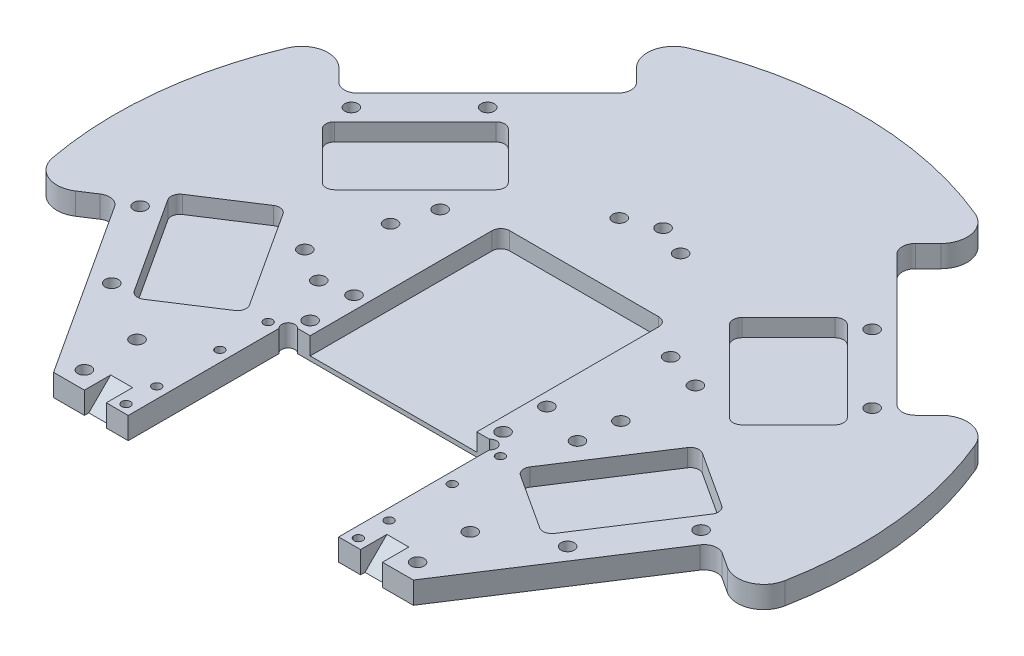
from build123d import *

# Parameters (mm, degrees)
SKETCH1_R            = 85
BOSS_EXTRUDE1_DEPTH  = 5
CUT_EXTRUDE1_REACH   = 122.312
SKETCH2_R            = 1.5
CUT_EXTRUDE2_DEPTH   = 4
FILLET2_R            = 2
FILLET3_R            = 6
FILLET4_R            = 3
FILLET2_OF_MIRROR1_R = 2
FILLET3_OF_MIRROR1_R = 6
FILLET4_OF_MIRROR1_R = 3
MIRROR2_START        = 1
MIRROR2_OUTLINE_R    = 1.5
MIRROR2_DEPTH        = 4
MIRROR2_2_OUTLINE_R  = 1.5
MIRROR2_2_DEPTH      = 1
CUT_EXTRUDE3_REACH   = 122.312
CUT_EXTRUDE4_REACH   = 122.312
SKETCH5_R            = 1.5
CUT_EXTRUDE5_REACH   = 122.312
SKETCH6_R            = 1.5
CUT_EXTRUDE6_REACH   = 122.312
SKETCH7_R            = 1.5
CUT_EXTRUDE7_REACH   = 122.312
SKETCH8_R            = 1
SKETCH8_R_2          = 1.5
CUT_EXTRUDE8_START   = -5
CUT_EXTRUDE8_DEPTH   = 5
CUT_EXTRUDE9_DEPTH   = 4


# Read off the part's stored shape, not the designer's step: Mirror2
with BuildPart() as part:
    # Sketch1 → Boss-Extrude1 (new body)
    with BuildSketch(Plane(origin=(0, 0, 0), x_dir=(1, 0, 0), z_dir=(0, 1, 0))):
        with Locations(Location((0, 0, 0), (0, 0, 270))):
            Circle(SKETCH1_R)
    extrude(amount=BOSS_EXTRUDE1_DEPTH)

    # Sketch2 → Cut-Extrude1 (cut, up to next)
    with BuildSketch(Plane(origin=(0, 5, 0), x_dir=(1, 0, 0), z_dir=(0, 1, 0)), mode=Mode.PRIVATE) as cut_extrude1_sk1:
        with Locations(Location((-59.39696962, 28.284271247, 0), (0, 0, 270))):
            Circle(SKETCH2_R)
    cut_extrude1_tool1 = extrude(cut_extrude1_sk1.sketch, amount=-CUT_EXTRUDE1_REACH, mode=Mode.PRIVATE) & part.part
    # Sketch2 → Cut-Extrude1 (cut, up to next)
    with BuildSketch(Plane(origin=(0, 5, 0), x_dir=(1, 0, 0), z_dir=(0, 1, 0)), mode=Mode.PRIVATE) as cut_extrude1_sk2:
        with Locations(Location((-43.840620434, 43.840620434, 0), (0, 0, 270))):
            Circle(SKETCH2_R)
    cut_extrude1_tool2 = extrude(cut_extrude1_sk2.sketch, amount=-CUT_EXTRUDE1_REACH, mode=Mode.PRIVATE) & part.part
    # Sketch2 → Cut-Extrude1 (cut, up to next)
    with BuildSketch(Plane(origin=(0, 5, 0), x_dir=(1, 0, 0), z_dir=(0, 1, 0)), mode=Mode.PRIVATE) as cut_extrude1_sk3:
        with BuildLine():
            Line((-40.687914512, 74.629040009), (-29.69848481, 63.639610307))
            Line((-29.69848481, 63.639610307), (-63.639610307, 29.69848481))
            Line((-63.639610307, 29.69848481), (-74.629040009, 40.687914512))
            ThreePointArc((-74.629040009, 40.687914512), (-60.104076401, 60.104076401), (-40.687914512, 74.629040009))
        make_face()
    cut_extrude1_tool3 = extrude(cut_extrude1_sk3.sketch, amount=-CUT_EXTRUDE1_REACH, mode=Mode.PRIVATE) & part.part
    cut_extrude1_1 = cut_extrude1_tool1.solids().sort_by_distance((-59.39697, 5, -28.284271))[0]
    add(cut_extrude1_1, mode=Mode.SUBTRACT)
    cut_extrude1_2 = cut_extrude1_tool2.solids().sort_by_distance((-43.84062, 5, -43.84062))[0]
    add(cut_extrude1_2, mode=Mode.SUBTRACT)
    cut_extrude1_3 = cut_extrude1_tool3.solids().sort_by_distance((-53.003264, 5, -53.003264))[0]
    add(cut_extrude1_3, mode=Mode.SUBTRACT)
    cut_extrude1 = cut_extrude1_1 + cut_extrude1_2 + cut_extrude1_3  # Cut-Extrude1 as one shape, for the pattern or mirror that repeats it

    # Sketch3 → Cut-Extrude2 (cut)
    with BuildSketch(Plane(origin=(0, 5, 0), x_dir=(1, 0, 0), z_dir=(0, 1, 0))):
        Polygon((-59.877802231, 22.146584387), (-38.664598795, 43.359787822), (-25.229569953, 29.92475898), (-46.442773388, 8.711555544), align=None)
    cut_extrude2 = extrude(amount=-CUT_EXTRUDE2_DEPTH, mode=Mode.SUBTRACT)

    # Fillet2
    fillet2_edges = [part.edges().sort_by_distance(p)[0] for p in [
        (-46.442773388, 3, -8.711555544),
        (-59.877802231, 3, -22.146584387),
        (-38.664598795, 3, -43.359787822),
        (-25.229569953, 3, -29.92475898),
    ]]
    fillet(fillet2_edges, radius=FILLET2_R)

    # Fillet3
    fillet3_edges = [part.edges().sort_by_distance(p)[0] for p in [
        (-40.687914512, 2.5, -74.629040009),
        (-74.629040009, 2.5, -40.687914512),
    ]]
    fillet(fillet3_edges, radius=FILLET3_R)

    # Fillet4
    fillet4_edges = [part.edges().sort_by_distance(p)[0] for p in [
        (-29.69848481, 2.5, -63.639610307),
        (-63.639610307, 2.5, -29.69848481),
    ]]
    fillet(fillet4_edges, radius=FILLET4_R)

    # Mirror1: Cut-Extrude1, Cut-Extrude2 across plane
    add(cut_extrude1.mirror(Plane(origin=(0, 0, 0), x_dir=(0.9945218953682733, 0, 0.10452846326765369), z_dir=(-0.10452846326765369, 0, 0.9945218953682733))), mode=Mode.SUBTRACT)
    add(cut_extrude2.mirror(Plane(origin=(0, 0, 0), x_dir=(0.9945218953682733, 0, 0.10452846326765369), z_dir=(-0.10452846326765369, 0, 0.9945218953682733))), mode=Mode.SUBTRACT)

    # Fillet2 of Mirror1
    fillet2_of_mirror1_edges = [part.edges().sort_by_distance(p)[0] for p in [
        (-47.239121604, 3, -1.134808387),
        (-63.173862395, 3, 9.213333278),
        (-46.834691345, 3, 34.373450316),
        (-30.899950554, 3, 24.025308651),
    ]]
    fillet(fillet2_of_mirror1_edges, radius=FILLET2_OF_MIRROR1_R)

    # Fillet3 of Mirror1
    fillet3_of_mirror1_edges = [part.edges().sort_by_distance(p)[0] for p in [
        (-55.315035851, 2.5, 64.538723328),
        (-81.457709532, 2.5, 24.282536066),
    ]]
    fillet(fillet3_of_mirror1_edges, radius=FILLET3_OF_MIRROR1_R)

    # Fillet4 of Mirror1
    fillet4_of_mirror1_edges = [part.edges().sort_by_distance(p)[0] for p in [
        (-42.280920644, 2.5, 56.074269942),
        (-68.423594325, 2.5, 15.81808268),
    ]]
    fillet(fillet4_of_mirror1_edges, radius=FILLET4_OF_MIRROR1_R)

    # Mirror2 outline → Mirror2 (cut)
    with BuildSketch(Plane(origin=(0, 0, 0), x_dir=(1, 0, 0), z_dir=(0, 1, 0)).offset(MIRROR2_START)):
        with BuildLine():
            ThreePointArc((43.914837749, -53.558258238), (43.496406651, -55.815910416), (44.796932348, -57.708187047))
            Line((44.796932348, -57.708187047), (48.220507685, -59.931482867))
            ThreePointArc((48.220507685, -59.931482867), (50.952027138, -64.875440225), (48.366800574, -69.89744346))
            ThreePointArc((48.366800574, -69.89744346), (71.286998275, -46.294317976), (83.527042075, -15.755419453))
            ThreePointArc((83.527042075, -15.755419453), (79.990720206, -20.159774174), (74.363181366, -19.675295605))
            Line((74.363181366, -19.675295605), (70.939606029, -17.451999785))
            ThreePointArc((70.939606029, -17.451999785), (68.681953851, -17.033568687), (66.78967722, -18.334094384))
            Line((66.78967722, -18.334094384), (43.914837749, -53.558258238))
        make_face()
        with BuildLine():
            ThreePointArc((68.647443459, 34.706317962), (74.051278315, 36.350240628), (78.426039904, 32.777374283))
            ThreePointArc((78.426039904, 32.777374283), (60.1040764, 60.1040764), (32.777374283, 78.426039904))
            ThreePointArc((32.777374283, 78.426039904), (36.350240628, 74.051278315), (34.706317962, 68.647443459))
            Line((34.706317962, 68.647443459), (31.819805153, 65.76093065))
            ThreePointArc((31.819805153, 65.76093065), (30.941125497, 63.639610307), (31.819805153, 61.518289963))
            Line((31.819805153, 61.518289963), (61.518289963, 31.819805153))
            ThreePointArc((61.518289963, 31.819805153), (63.639610307, 30.941125497), (65.76093065, 31.819805153))
            Line((65.76093065, 31.819805153), (68.647443459, 34.706317962))
        make_face()
        with Locations((63.979633983, -15.316867676)):
            Circle(MIRROR2_OUTLINE_R)
        with Locations((51.997575213, -33.767620171)):
            Circle(MIRROR2_OUTLINE_R)
        with BuildLine():
            ThreePointArc((62.084584325, -10.890674414), (62.363538391, -9.385572962), (61.496521259, -8.124055208))
            Line((61.496521259, -8.124055208), (48.91646274, 0.045530317))
            ThreePointArc((48.91646274, 0.045530317), (47.411361288, 0.324484383), (46.149843534, -0.542532749))
            Line((46.149843534, -0.542532749), (31.989228624, -22.347967515))
            ThreePointArc((31.989228624, -22.347967515), (31.710274558, -23.853068967), (32.57729169, -25.114586721))
            Line((32.57729169, -25.114586721), (45.157350209, -33.284172246))
            ThreePointArc((45.157350209, -33.284172246), (46.66245166, -33.563126312), (47.923969415, -32.696109181))
            Line((47.923969415, -32.696109181), (62.084584325, -10.890674414))
        make_face()
        with Locations((59.39696962, 28.284271247)):
            Circle(MIRROR2_OUTLINE_R)
        with Locations((43.840620434, 43.840620434)):
            Circle(MIRROR2_OUTLINE_R)
        with BuildLine():
            Line((47.856986951, 10.125769107), (58.463588669, 20.732370824))
            ThreePointArc((58.463588669, 20.732370824), (59.049375106, 22.146584387), (58.463588669, 23.560797949))
            Line((58.463588669, 23.560797949), (40.078812358, 41.94557426))
            ThreePointArc((40.078812358, 41.94557426), (38.664598796, 42.531360698), (37.250385233, 41.94557426))
            Line((37.250385233, 41.94557426), (26.643783515, 31.338972542))
            ThreePointArc((26.643783515, 31.338972542), (26.057997077, 29.924758979), (26.643783515, 28.510545417))
            Line((26.643783515, 28.510545417), (45.028559826, 10.125769107))
            ThreePointArc((45.028559826, 10.125769107), (46.442773389, 9.539982669), (47.856986951, 10.125769107))
        make_face()
    extrude(amount=MIRROR2_DEPTH, mode=Mode.SUBTRACT)

    # Mirror2 2 outline → Mirror2 2 (cut)
    with BuildSketch(Plane(origin=(0, 0, 0), x_dir=(1, 0, 0), z_dir=(0, 1, 0))):
        with BuildLine():
            ThreePointArc((43.914837749, -53.558258238), (43.496406651, -55.815910416), (44.796932348, -57.708187047))
            Line((44.796932348, -57.708187047), (48.220507685, -59.931482867))
            ThreePointArc((48.220507685, -59.931482867), (50.952027138, -64.875440225), (48.366800574, -69.89744346))
            ThreePointArc((48.366800574, -69.89744346), (71.286998275, -46.294317976), (83.527042075, -15.755419453))
            ThreePointArc((83.527042075, -15.755419453), (79.990720206, -20.159774174), (74.363181366, -19.675295605))
            Line((74.363181366, -19.675295605), (70.939606029, -17.451999785))
            ThreePointArc((70.939606029, -17.451999785), (68.681953851, -17.033568687), (66.78967722, -18.334094384))
            Line((66.78967722, -18.334094384), (43.914837749, -53.558258238))
        make_face()
        with BuildLine():
            ThreePointArc((68.647443459, 34.706317962), (74.051278315, 36.350240628), (78.426039904, 32.777374283))
            ThreePointArc((78.426039904, 32.777374283), (60.1040764, 60.1040764), (32.777374283, 78.426039904))
            ThreePointArc((32.777374283, 78.426039904), (36.350240628, 74.051278315), (34.706317962, 68.647443459))
            Line((34.706317962, 68.647443459), (31.819805153, 65.76093065))
            ThreePointArc((31.819805153, 65.76093065), (30.941125497, 63.639610307), (31.819805153, 61.518289963))
            Line((31.819805153, 61.518289963), (61.518289963, 31.819805153))
            ThreePointArc((61.518289963, 31.819805153), (63.639610307, 30.941125497), (65.76093065, 31.819805153))
            Line((65.76093065, 31.819805153), (68.647443459, 34.706317962))
        make_face()
        with Locations((63.979633983, -15.316867676)):
            Circle(MIRROR2_2_OUTLINE_R)
        with Locations((51.997575213, -33.767620171)):
            Circle(MIRROR2_2_OUTLINE_R)
        with Locations((59.39696962, 28.284271247)):
            Circle(MIRROR2_2_OUTLINE_R)
        with Locations((43.840620434, 43.840620434)):
            Circle(MIRROR2_2_OUTLINE_R)
    extrude(amount=MIRROR2_2_DEPTH, mode=Mode.SUBTRACT)

    # Sketch4 → Cut-Extrude3 (cut, up to next)
    with BuildSketch(Plane(origin=(0, 5, 0), x_dir=(1, 0, 0), z_dir=(0, 1, 0)), mode=Mode.PRIVATE) as cut_extrude3_sk1:
        Polygon((-43.914837749, -53.558258238), (-41.030336922, -58), (-24, -58), (-24, -21.5), (24, -21.5), (24, -58), (41.030336922, -58), (43.914837749, -53.558258238), (50.952673475, -58.128682198), (50.952673475, -85), (-50.952673475, -85), (-50.952673475, -58.128682198), align=None)
    cut_extrude3_tool1 = extrude(cut_extrude3_sk1.sketch, amount=-CUT_EXTRUDE3_REACH, mode=Mode.PRIVATE) & part.part
    add(cut_extrude3_tool1.solids().sort_by_distance((0, 5, 59.123155))[0], mode=Mode.SUBTRACT)

    # Sketch5 → Cut-Extrude4 (cut, up to next)
    with BuildSketch(Plane(origin=(0, 5, 0), x_dir=(1, 0, 0), z_dir=(0, 1, 0)), mode=Mode.PRIVATE) as cut_extrude4_sk1:
        with Locations((-23, -22.5)):
            Circle(SKETCH5_R)
    cut_extrude4_tool1 = extrude(cut_extrude4_sk1.sketch, amount=-CUT_EXTRUDE4_REACH, mode=Mode.PRIVATE) & part.part
    # Sketch5 → Cut-Extrude4 (cut, up to next)
    with BuildSketch(Plane(origin=(0, 5, 0), x_dir=(1, 0, 0), z_dir=(0, 1, 0)), mode=Mode.PRIVATE) as cut_extrude4_sk2:
        with Locations((23, -22.5)):
            Circle(SKETCH5_R)
    cut_extrude4_tool2 = extrude(cut_extrude4_sk2.sketch, amount=-CUT_EXTRUDE4_REACH, mode=Mode.PRIVATE) & part.part
    add(cut_extrude4_tool1.solids().sort_by_distance((-23, 5, 22.5))[0], mode=Mode.SUBTRACT)
    add(cut_extrude4_tool2.solids().sort_by_distance((23, 5, 22.5))[0], mode=Mode.SUBTRACT)

    # Sketch6 → Cut-Extrude5 (cut, up to next)
    with BuildSketch(Plane(origin=(0, 5, 0), x_dir=(1, 0, 0), z_dir=(0, 1, 0)), mode=Mode.PRIVATE) as cut_extrude5_sk1:
        with Locations(Location((-29.118657249, 18.25749709, 0), (0, 0, 270))):
            Circle(SKETCH6_R)
    cut_extrude5_tool1 = extrude(cut_extrude5_sk1.sketch, amount=-CUT_EXTRUDE5_REACH, mode=Mode.PRIVATE) & part.part
    # Sketch6 → Cut-Extrude5 (cut, up to next)
    with BuildSketch(Plane(origin=(0, 5, 0), x_dir=(1, 0, 0), z_dir=(0, 1, 0)), mode=Mode.PRIVATE) as cut_extrude5_sk2:
        with Locations(Location((-31.947084374, 9.772215716, 0), (0, 0, 270))):
            Circle(SKETCH6_R)
    cut_extrude5_tool2 = extrude(cut_extrude5_sk2.sketch, amount=-CUT_EXTRUDE5_REACH, mode=Mode.PRIVATE) & part.part
    # Sketch6 → Cut-Extrude5 (cut, up to next)
    with BuildSketch(Plane(origin=(0, 5, 0), x_dir=(1, 0, 0), z_dir=(0, 1, 0)), mode=Mode.PRIVATE) as cut_extrude5_sk3:
        with Locations(Location((-36.635404095, -5.095053168, 0), (0, 0, 270))):
            Circle(SKETCH6_R)
    cut_extrude5_tool3 = extrude(cut_extrude5_sk3.sketch, amount=-CUT_EXTRUDE5_REACH, mode=Mode.PRIVATE) & part.part
    # Sketch6 → Cut-Extrude5 (cut, up to next)
    with BuildSketch(Plane(origin=(0, 5, 0), x_dir=(1, 0, 0), z_dir=(0, 1, 0)), mode=Mode.PRIVATE) as cut_extrude5_sk4:
        with Locations(Location((-28.923609543, -9.625861571, 0), (0, 0, 270))):
            Circle(SKETCH6_R)
    cut_extrude5_tool4 = extrude(cut_extrude5_sk4.sketch, amount=-CUT_EXTRUDE5_REACH, mode=Mode.PRIVATE) & part.part
    # Sketch6 → Cut-Extrude5 (cut, up to next)
    with BuildSketch(Plane(origin=(0, 5, 0), x_dir=(1, 0, 0), z_dir=(0, 1, 0)), mode=Mode.PRIVATE) as cut_extrude5_sk5:
        with Locations(Location((33.280721823, -2.916497028, 0), (0, 0, 270))):
            Circle(SKETCH6_R)
    cut_extrude5_tool5 = extrude(cut_extrude5_sk5.sketch, amount=-CUT_EXTRUDE5_REACH, mode=Mode.PRIVATE) & part.part
    # Sketch6 → Cut-Extrude5 (cut, up to next)
    with BuildSketch(Plane(origin=(0, 5, 0), x_dir=(1, 0, 0), z_dir=(0, 1, 0)), mode=Mode.PRIVATE) as cut_extrude5_sk6:
        with Locations(Location((32.278291815, -11.804417711, 0), (0, 0, 270))):
            Circle(SKETCH6_R)
    cut_extrude5_tool6 = extrude(cut_extrude5_sk6.sketch, amount=-CUT_EXTRUDE5_REACH, mode=Mode.PRIVATE) & part.part
    # Sketch6 → Cut-Extrude5 (cut, up to next)
    with BuildSketch(Plane(origin=(0, 5, 0), x_dir=(1, 0, 0), z_dir=(0, 1, 0)), mode=Mode.PRIVATE) as cut_extrude5_sk7:
        with Locations(Location((26.290230125, 15.429069965, 0), (0, 0, 270))):
            Circle(SKETCH6_R)
    cut_extrude5_tool7 = extrude(cut_extrude5_sk7.sketch, amount=-CUT_EXTRUDE5_REACH, mode=Mode.PRIVATE) & part.part
    # Sketch6 → Cut-Extrude5 (cut, up to next)
    with BuildSketch(Plane(origin=(0, 5, 0), x_dir=(1, 0, 0), z_dir=(0, 1, 0)), mode=Mode.PRIVATE) as cut_extrude5_sk8:
        with Locations(Location((34.775511499, 12.600642841, 0), (0, 0, 270))):
            Circle(SKETCH6_R)
    cut_extrude5_tool8 = extrude(cut_extrude5_sk8.sketch, amount=-CUT_EXTRUDE5_REACH, mode=Mode.PRIVATE) & part.part
    add(cut_extrude5_tool1.solids().sort_by_distance((-29.118657, 5, -18.257497))[0], mode=Mode.SUBTRACT)
    add(cut_extrude5_tool2.solids().sort_by_distance((-31.947084, 5, -9.772216))[0], mode=Mode.SUBTRACT)
    add(cut_extrude5_tool3.solids().sort_by_distance((-36.635404, 5, 5.095053))[0], mode=Mode.SUBTRACT)
    add(cut_extrude5_tool4.solids().sort_by_distance((-28.92361, 5, 9.625862))[0], mode=Mode.SUBTRACT)
    add(cut_extrude5_tool5.solids().sort_by_distance((33.280722, 5, 2.916497))[0], mode=Mode.SUBTRACT)
    add(cut_extrude5_tool6.solids().sort_by_distance((32.278292, 5, 11.804418))[0], mode=Mode.SUBTRACT)
    add(cut_extrude5_tool7.solids().sort_by_distance((26.29023, 5, -15.42907))[0], mode=Mode.SUBTRACT)
    add(cut_extrude5_tool8.solids().sort_by_distance((34.775511, 5, -12.600643))[0], mode=Mode.SUBTRACT)

    # Sketch7 → Cut-Extrude6 (cut, up to next)
    with BuildSketch(Plane(origin=(0, 5, 0), x_dir=(1, 0, 0), z_dir=(0, 1, 0)), mode=Mode.PRIVATE) as cut_extrude6_sk1:
        with Locations(Location((0, 40, 0), (0, 0, 270))):
            Circle(SKETCH7_R)
    cut_extrude6_tool1 = extrude(cut_extrude6_sk1.sketch, amount=-CUT_EXTRUDE6_REACH, mode=Mode.PRIVATE) & part.part
    # Sketch7 → Cut-Extrude6 (cut, up to next)
    with BuildSketch(Plane(origin=(0, 5, 0), x_dir=(1, 0, 0), z_dir=(0, 1, 0)), mode=Mode.PRIVATE) as cut_extrude6_sk2:
        with Locations(Location((7, 37, 0), (0, 0, 270))):
            Circle(SKETCH7_R)
    cut_extrude6_tool2 = extrude(cut_extrude6_sk2.sketch, amount=-CUT_EXTRUDE6_REACH, mode=Mode.PRIVATE) & part.part
    # Sketch7 → Cut-Extrude6 (cut, up to next)
    with BuildSketch(Plane(origin=(0, 5, 0), x_dir=(1, 0, 0), z_dir=(0, 1, 0)), mode=Mode.PRIVATE) as cut_extrude6_sk3:
        with Locations(Location((-7, 37, 0), (0, 0, 270))):
            Circle(SKETCH7_R)
    cut_extrude6_tool3 = extrude(cut_extrude6_sk3.sketch, amount=-CUT_EXTRUDE6_REACH, mode=Mode.PRIVATE) & part.part
    # Sketch7 → Cut-Extrude6 (cut, up to next)
    with BuildSketch(Plane(origin=(0, 5, 0), x_dir=(1, 0, 0), z_dir=(0, 1, 0)), mode=Mode.PRIVATE) as cut_extrude6_sk4:
        with Locations(Location((-22, -8.5, 0), (0, 0, 270))):
            Circle(SKETCH7_R)
    cut_extrude6_tool4 = extrude(cut_extrude6_sk4.sketch, amount=-CUT_EXTRUDE6_REACH, mode=Mode.PRIVATE) & part.part
    # Sketch7 → Cut-Extrude6 (cut, up to next)
    with BuildSketch(Plane(origin=(0, 5, 0), x_dir=(1, 0, 0), z_dir=(0, 1, 0)), mode=Mode.PRIVATE) as cut_extrude6_sk5:
        with Locations(Location((-22, -18.5, 0), (0, 0, 270))):
            Circle(SKETCH7_R)
    cut_extrude6_tool5 = extrude(cut_extrude6_sk5.sketch, amount=-CUT_EXTRUDE6_REACH, mode=Mode.PRIVATE) & part.part
    # Sketch7 → Cut-Extrude6 (cut, up to next)
    with BuildSketch(Plane(origin=(0, 5, 0), x_dir=(1, 0, 0), z_dir=(0, 1, 0)), mode=Mode.PRIVATE) as cut_extrude6_sk6:
        with Locations(Location((22, -18.5, 0), (0, 0, 270))):
            Circle(SKETCH7_R)
    cut_extrude6_tool6 = extrude(cut_extrude6_sk6.sketch, amount=-CUT_EXTRUDE6_REACH, mode=Mode.PRIVATE) & part.part
    # Sketch7 → Cut-Extrude6 (cut, up to next)
    with BuildSketch(Plane(origin=(0, 5, 0), x_dir=(1, 0, 0), z_dir=(0, 1, 0)), mode=Mode.PRIVATE) as cut_extrude6_sk7:
        with Locations(Location((22, -8.5, 0), (0, 0, 270))):
            Circle(SKETCH7_R)
    cut_extrude6_tool7 = extrude(cut_extrude6_sk7.sketch, amount=-CUT_EXTRUDE6_REACH, mode=Mode.PRIVATE) & part.part
    add(cut_extrude6_tool1.solids().sort_by_distance((0, 5, -40))[0], mode=Mode.SUBTRACT)
    add(cut_extrude6_tool2.solids().sort_by_distance((7, 5, -37))[0], mode=Mode.SUBTRACT)
    add(cut_extrude6_tool3.solids().sort_by_distance((-7, 5, -37))[0], mode=Mode.SUBTRACT)
    add(cut_extrude6_tool4.solids().sort_by_distance((-22, 5, 8.5))[0], mode=Mode.SUBTRACT)
    add(cut_extrude6_tool5.solids().sort_by_distance((-22, 5, 18.5))[0], mode=Mode.SUBTRACT)
    add(cut_extrude6_tool6.solids().sort_by_distance((22, 5, 18.5))[0], mode=Mode.SUBTRACT)
    add(cut_extrude6_tool7.solids().sort_by_distance((22, 5, 8.5))[0], mode=Mode.SUBTRACT)

    # Sketch8 → Cut-Extrude7 (cut, up to next)
    with BuildSketch(Plane(origin=(0, 5, 0), x_dir=(1, 0, 0), z_dir=(0, 1, 0)), mode=Mode.PRIVATE) as cut_extrude7_sk1:
        with Locations(Location((-26.5, -23.6, 0), (0, 0, 270))):
            Circle(SKETCH8_R)
    cut_extrude7_tool1 = extrude(cut_extrude7_sk1.sketch, amount=-CUT_EXTRUDE7_REACH, mode=Mode.PRIVATE) & part.part
    # Sketch8 → Cut-Extrude7 (cut, up to next)
    with BuildSketch(Plane(origin=(0, 5, 0), x_dir=(1, 0, 0), z_dir=(0, 1, 0)), mode=Mode.PRIVATE) as cut_extrude7_sk2:
        with Locations(Location((-26.5, -34.6, 0), (0, 0, 270))):
            Circle(SKETCH8_R)
    cut_extrude7_tool2 = extrude(cut_extrude7_sk2.sketch, amount=-CUT_EXTRUDE7_REACH, mode=Mode.PRIVATE) & part.part
    # Sketch8 → Cut-Extrude7 (cut, up to next)
    with BuildSketch(Plane(origin=(0, 5, 0), x_dir=(1, 0, 0), z_dir=(0, 1, 0)), mode=Mode.PRIVATE) as cut_extrude7_sk3:
        with Locations(Location((-26.5, -49, 0), (0, 0, 270))):
            Circle(SKETCH8_R)
    cut_extrude7_tool3 = extrude(cut_extrude7_sk3.sketch, amount=-CUT_EXTRUDE7_REACH, mode=Mode.PRIVATE) & part.part
    # Sketch8 → Cut-Extrude7 (cut, up to next)
    with BuildSketch(Plane(origin=(0, 5, 0), x_dir=(1, 0, 0), z_dir=(0, 1, 0)), mode=Mode.PRIVATE) as cut_extrude7_sk4:
        with Locations(Location((-26.5, -56, 0), (0, 0, 270))):
            Circle(SKETCH8_R)
    cut_extrude7_tool4 = extrude(cut_extrude7_sk4.sketch, amount=-CUT_EXTRUDE7_REACH, mode=Mode.PRIVATE) & part.part
    # Sketch8 → Cut-Extrude7 (cut, up to next)
    with BuildSketch(Plane(origin=(0, 5, 0), x_dir=(1, 0, 0), z_dir=(0, 1, 0)), mode=Mode.PRIVATE) as cut_extrude7_sk5:
        with Locations(Location((-38, -54, 0), (0, 0, 270))):
            Circle(SKETCH8_R_2)
    cut_extrude7_tool5 = extrude(cut_extrude7_sk5.sketch, amount=-CUT_EXTRUDE7_REACH, mode=Mode.PRIVATE) & part.part
    # Sketch8 → Cut-Extrude7 (cut, up to next)
    with BuildSketch(Plane(origin=(0, 5, 0), x_dir=(1, 0, 0), z_dir=(0, 1, 0)), mode=Mode.PRIVATE) as cut_extrude7_sk6:
        with Locations(Location((-38, -42, 0), (0, 0, 270))):
            Circle(SKETCH8_R_2)
    cut_extrude7_tool6 = extrude(cut_extrude7_sk6.sketch, amount=-CUT_EXTRUDE7_REACH, mode=Mode.PRIVATE) & part.part
    cut_extrude7_1 = cut_extrude7_tool1.solids().sort_by_distance((-26.5, 5, 23.6))[0]
    add(cut_extrude7_1, mode=Mode.SUBTRACT)
    cut_extrude7_2 = cut_extrude7_tool2.solids().sort_by_distance((-26.5, 5, 34.6))[0]
    add(cut_extrude7_2, mode=Mode.SUBTRACT)
    cut_extrude7_3 = cut_extrude7_tool3.solids().sort_by_distance((-26.5, 5, 49))[0]
    add(cut_extrude7_3, mode=Mode.SUBTRACT)
    cut_extrude7_4 = cut_extrude7_tool4.solids().sort_by_distance((-26.5, 5, 56))[0]
    add(cut_extrude7_4, mode=Mode.SUBTRACT)
    cut_extrude7_5 = cut_extrude7_tool5.solids().sort_by_distance((-38, 5, 54))[0]
    add(cut_extrude7_5, mode=Mode.SUBTRACT)
    cut_extrude7_6 = cut_extrude7_tool6.solids().sort_by_distance((-38, 5, 42))[0]
    add(cut_extrude7_6, mode=Mode.SUBTRACT)
    cut_extrude7 = cut_extrude7_1 + cut_extrude7_2 + cut_extrude7_3 + cut_extrude7_4 + cut_extrude7_5 + cut_extrude7_6  # Cut-Extrude7 as one shape, for the pattern or mirror that repeats it

    # Mirror3: Cut-Extrude7 across plane
    add(cut_extrude7.mirror(Plane(origin=(0, 0, 0), x_dir=(0, 0, 1), z_dir=(1, 0, 0))), mode=Mode.SUBTRACT)

    # Sketch9 → Cut-Extrude8 (cut)
    with BuildSketch(Plane(origin=(-24, 0, 0), x_dir=(0, 0, -1), z_dir=(1, 0, 0)).offset(CUT_EXTRUDE8_START)):
        Polygon((-52, 5), (-57, 0), (-58, 0), (-58, 5), align=None)
    cut_extrude8 = extrude(amount=-CUT_EXTRUDE8_DEPTH, mode=Mode.SUBTRACT)

    # Mirror4: Cut-Extrude8 across plane
    add(cut_extrude8.mirror(Plane(origin=(0, 0, 0), x_dir=(0, 0, 1), z_dir=(1, 0, 0))), mode=Mode.SUBTRACT)

    # Sketch10 → Cut-Extrude9 (cut)
    with BuildSketch(Plane(origin=(0, 5, 0), x_dir=(1, 0, 0), z_dir=(0, 1, 0))):
        with BuildLine():
            Line((-19, -21.5), (19, -21.5))
            Line((19, -21.5), (19, 20))
            ThreePointArc((19, 20), (18.414213562, 21.414213562), (17, 22))
            Line((17, 22), (-17, 22))
            ThreePointArc((-17, 22), (-18.414213562, 21.414213562), (-19, 20))
            Line((-19, 20), (-19, -21.5))
        make_face()
    extrude(amount=-CUT_EXTRUDE9_DEPTH, mode=Mode.SUBTRACT)


solid = part.part
